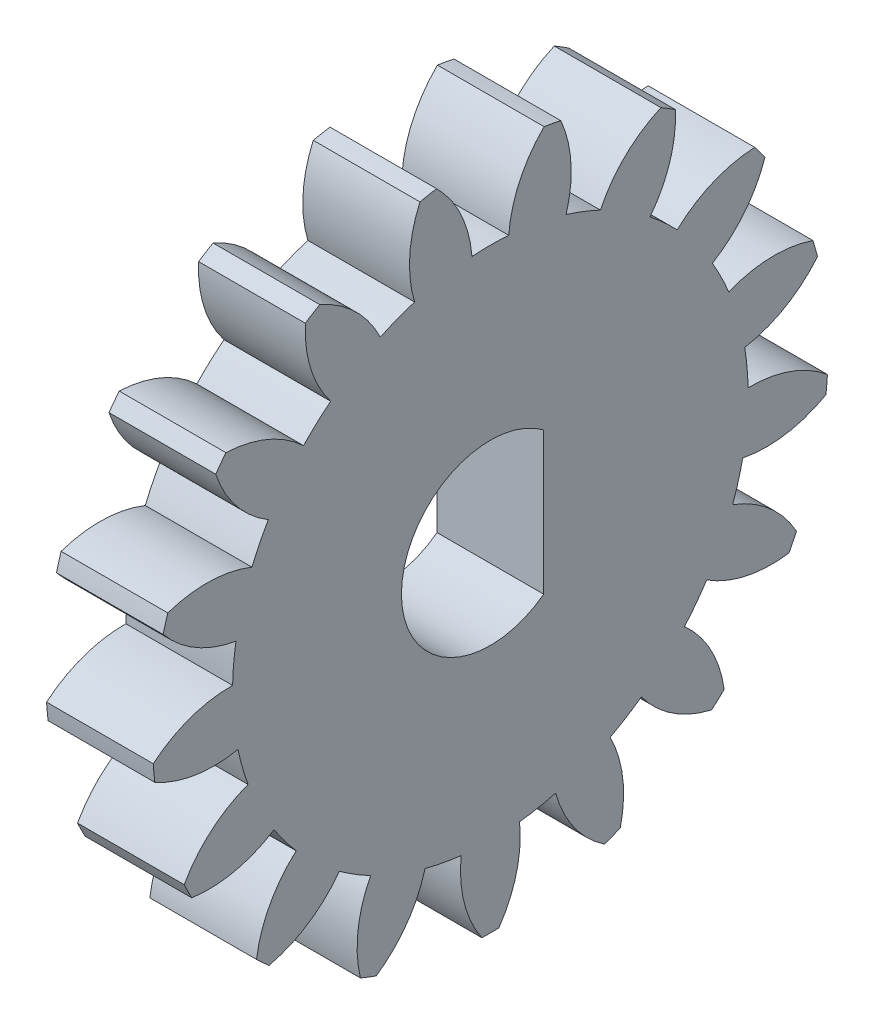
from build123d import *

# Parameters (mm, degrees)
BASPROSKE_W     = 3
BASPROSKE_H     = 9.5
TOOTHCUT_DEPTH  = 14.765899898
TEETHCUTS_COUNT = 17
TEETHCUTS_ANGLE = 338.823529412
BORSKE_R        = 2.5
BORE_DEPTH      = 50.0000508
EXTRUDE_1_DEPTH = 3


with BuildPart() as part:
    # BasProSke → Base-Revolve (revolve)
    with BuildSketch(Plane(origin=(0, 0, 0), x_dir=(1, 0, 0), z_dir=(0, 1, 0))):
        with Locations((1.5, 4.75)):
            Rectangle(BASPROSKE_W, BASPROSKE_H)
    revolve(axis=Axis((-10, 0, 0), (1, 0, 0)))

    # TooCutSke → ToothCut (cut, through all)
    with BuildSketch(Plane(origin=(0, 0, 0), x_dir=(0, 0, -1), z_dir=(1, 0, 0))):
        with BuildLine():
            ThreePointArc((0.516861231, 7.23055015), (0, 7.249), (-0.516861231, 7.23055015))
            ThreePointArc((-0.516861231, 7.23055015), (-0.827352654, 8.408398361), (-1.533069197, 9.401220346))
            ThreePointArc((-1.533069197, 9.401220346), (0, 9.5254), (1.533069197, 9.401220346))
            ThreePointArc((1.533069197, 9.401220346), (0.827352654, 8.408398361), (0.516861231, 7.23055015))
        make_face()
    toothcut = extrude(amount=TOOTHCUT_DEPTH, mode=Mode.SUBTRACT)

    # TeethCuts: ToothCut ×17 about axis
    teethcuts_axis = Axis((-10, 0, 0), (1, 0, 0))
    for i in range(1, TEETHCUTS_COUNT):
        add(toothcut.rotate(teethcuts_axis, i * TEETHCUTS_ANGLE / (TEETHCUTS_COUNT - 1)), mode=Mode.SUBTRACT)

    # BorSke → Bore (cut, symmetric)
    with BuildSketch(Plane(origin=(0, 0, 0), x_dir=(0, 0, -1), z_dir=(1, 0, 0))):
        Circle(BORSKE_R)
    extrude(amount=BORE_DEPTH, both=True, mode=Mode.SUBTRACT)

    # 草图1 → 凸台-拉伸1 (add)
    with BuildSketch(Plane(origin=(3, 0, 0), x_dir=(0, 0, -1), z_dir=(1, 0, 0))):
        with BuildLine():
            Line((1.5, 2), (1.5, -2))
            ThreePointArc((1.5, -2), (2.5, 0), (1.5, 2))
        make_face()
    extrude(amount=-EXTRUDE_1_DEPTH)


solid = part.part
